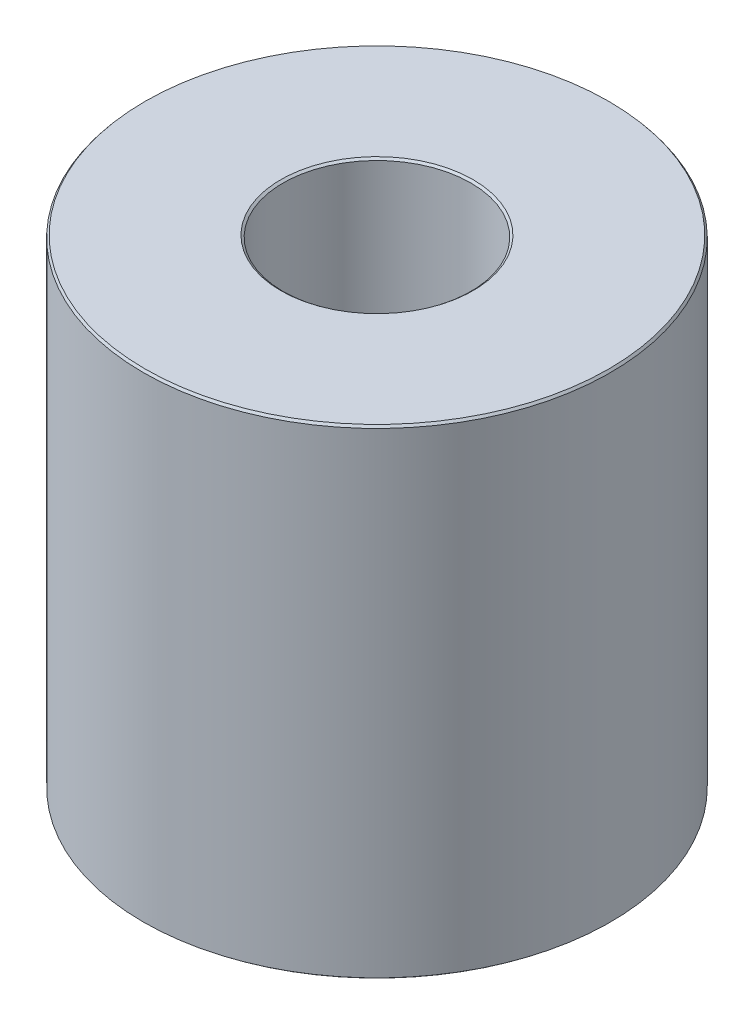
from build123d import *
from OCP.BRepFilletAPI import BRepFilletAPI_MakeChamfer

# Parameters (mm, degrees)
SKETCH1_R           = 32.5
BOSS_EXTRUDE1_DEPTH = 66.766926229
SKETCH2_R           = 13.070153139
CUT_EXTRUDE1_DEPTH  = 82.057525487
CHAMFER1_SIZE       = 0.313611467
CHAMFER1_SIZE2      = 0.245177629


with BuildPart() as part:
    # Sketch1 → Boss-Extrude1 (new body)
    with BuildSketch(Plane(origin=(0, 0, 0), x_dir=(1, 0, 0), z_dir=(0, 1, 0))):
        Circle(SKETCH1_R)
    extrude(amount=BOSS_EXTRUDE1_DEPTH)

    # Sketch2 → Cut-Extrude1 (cut, through all)
    with BuildSketch(Plane(origin=(0, 0, 0), x_dir=(1, 0, 0), z_dir=(0, 1, 0))):
        Circle(SKETCH2_R)
    extrude(amount=CUT_EXTRUDE1_DEPTH, mode=Mode.SUBTRACT)

    # Chamfer1: one chamfer whose edges measure the first distance from different faces: ONE call of the kernel's chamfer builder (chamfer() names one face for all edges)
    chamfer1_edges_1 = [part.edges().sort_by_distance(p)[0] for p in [
        (-13.070153139, 66.766926229, 0),
    ]]
    chamfer1_side_1 = [part.faces().sort_by_distance(p)[0] for p in [
        (-31.580761184, 66.766926229, 0),
    ]]
    chamfer1_edges_2 = [part.edges().sort_by_distance(p)[0] for p in [
        (-13.070153139, 0, 0),
    ]]
    chamfer1_side_2 = [part.faces().sort_by_distance(p)[0] for p in [
        (-13.070153139, 33.383463114, 0),
    ]]
    chamfer1_edges_3 = [part.edges().sort_by_distance(p)[0] for p in [
        (-32.5, 0, 0),
    ]]
    chamfer1_side_3 = [part.faces().sort_by_distance(p)[0] for p in [
        (-31.580761184, 0, 0),
    ]]
    chamfer1_edges_4 = [part.edges().sort_by_distance(p)[0] for p in [
        (-32.5, 66.766926229, 0),
    ]]
    chamfer1_side_4 = [part.faces().sort_by_distance(p)[0] for p in [
        (-32.5, 33.383463114, 0),
    ]]
    chamfer1 = BRepFilletAPI_MakeChamfer(part.part.solid().wrapped)
    for e in chamfer1_edges_1:
        chamfer1.Add(CHAMFER1_SIZE, CHAMFER1_SIZE2, e.wrapped, chamfer1_side_1[0].wrapped)  # the first distance lies on this face
    for e in chamfer1_edges_2:
        chamfer1.Add(CHAMFER1_SIZE, CHAMFER1_SIZE2, e.wrapped, chamfer1_side_2[0].wrapped)  # the first distance lies on this face
    for e in chamfer1_edges_3:
        chamfer1.Add(CHAMFER1_SIZE, CHAMFER1_SIZE2, e.wrapped, chamfer1_side_3[0].wrapped)  # the first distance lies on this face
    for e in chamfer1_edges_4:
        chamfer1.Add(CHAMFER1_SIZE, CHAMFER1_SIZE2, e.wrapped, chamfer1_side_4[0].wrapped)  # the first distance lies on this face
    add(Compound.cast(chamfer1.Shape()), mode=Mode.REPLACE)


solid = part.part
